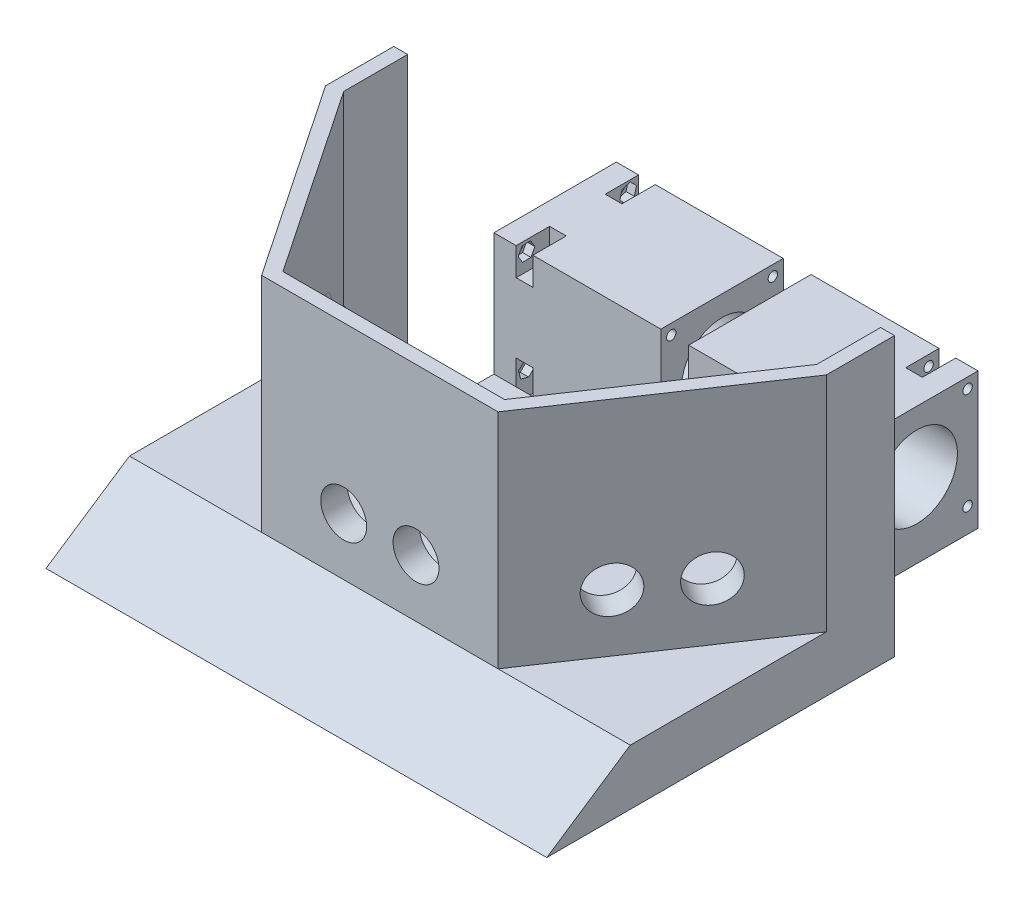
from build123d import *

# Parameters (mm, degrees)
SKETCH1_W           = 180
SKETCH1_H           = 100
BOSS_EXTRUDE1_DEPTH = 150
CUT_EXTRUDE2_DEPTH  = 80
SHELL1_T            = -5
BOSS_EXTRUDE2_DEPTH = 180
SKETCH26_W          = 180
SKETCH26_H          = 95
CUT_EXTRUDE10_DEPTH = 5
SKETCH27_W          = 50
SKETCH27_H          = 95
CUT_EXTRUDE11_DEPTH = 261.057303789
SKETCH28_R          = 8.25
CUT_EXTRUDE12_DEPTH = 82
SKETCH29_R          = 8.25
CUT_EXTRUDE13_DEPTH = 82
SKETCH30_R          = 8.25
CUT_EXTRUDE14_DEPTH = 82
SKETCH31_R          = 10.25
SKETCH31_R_2        = 8.25
BOSS_EXTRUDE4_DEPTH = 4.5
SKETCH33_R          = 10.25
SKETCH33_R_2        = 8.25
BOSS_EXTRUDE5_DEPTH = 4.5
SKETCH34_R          = 10.25
SKETCH34_R_2        = 8.25
BOSS_EXTRUDE6_DEPTH = 4.5
FILLET1_R           = 3
SKETCH36_W          = 60
SKETCH36_H          = 44
BOSS_EXTRUDE7_DEPTH = 44
SKETCH37_R          = 14.6
CUT_EXTRUDE15_DEPTH = 146
SKETCH42_R          = 1.6875
CUT_EXTRUDE19_DEPTH = 179.1
SKETCH43_W          = 25
SKETCH43_H          = 55
CUT_EXTRUDE20_DEPTH = 6.2
SKETCH47_W          = 6
SKETCH47_H          = 12
CUT_EXTRUDE24_DEPTH = 10
SKETCH55_W          = 6
SKETCH55_H          = 12
CUT_EXTRUDE31_DEPTH = 14
CUT_EXTRUDE36_DEPTH = 3
CUT_EXTRUDE37_DEPTH = 3
CUT_EXTRUDE38_DEPTH = 3
CUT_EXTRUDE39_DEPTH = 3


with BuildPart() as part:
    # Sketch1 → Boss-Extrude1 (new body)
    with BuildSketch(Plane.XY):
        with Locations((13.092783505, 3.195876289)):
            Rectangle(SKETCH1_W, SKETCH1_H)
    extrude(amount=BOSS_EXTRUDE1_DEPTH)

    # Sketch4 → Cut-Extrude2 (cut)
    with BuildSketch(Plane(origin=(0, 53.195876289, 0), x_dir=(1, 0, 0), z_dir=(0, 1, 0))):
        Polygon((-76.907216495, -79.510639101), (-29.407216495, -150), (-76.907216495, -150), align=None)
        Polygon((55.592783505, -150), (103.092783505, -150), (103.092783505, -79.510639101), align=None)
    extrude(amount=-CUT_EXTRUDE2_DEPTH, mode=Mode.SUBTRACT)

    # Shell1
    shell1_openings = [part.faces().sort_by_distance(p)[0] for p in [
        (13.092783505, 53.195876289, 67.708935527),
    ]]
    offset(amount=SHELL1_T, openings=shell1_openings, kind=Kind.INTERSECTION)

    # Sketch6 → Boss-Extrude2 (add)
    with BuildSketch(Plane(origin=(103.092783505, 0, 0), x_dir=(0, 0, -1), z_dir=(1, 0, 0))):
        Polygon((-150, -26.804123711), (-150, -46.804123711), (-180, -46.804123711), align=None)
    extrude(amount=-BOSS_EXTRUDE2_DEPTH)

    # Sketch26 → Cut-Extrude10 (cut)
    with BuildSketch(Plane(origin=(0, 0, 0), x_dir=(-1, 0, 0), z_dir=(0, 0, -1))):
        with Locations((-13.092783505, 5.695876289)):
            Rectangle(SKETCH26_W, SKETCH26_H)
    extrude(amount=-CUT_EXTRUDE10_DEPTH, mode=Mode.SUBTRACT)

    # Sketch27 → Cut-Extrude11 (cut, through all)
    with BuildSketch(Plane(origin=(103.092783505, 0, 0), x_dir=(0, 0, -1), z_dir=(1, 0, 0))):
        with Locations((-30, 5.695876289)):
            Rectangle(SKETCH27_W, SKETCH27_H)
    extrude(amount=-CUT_EXTRUDE11_DEPTH, mode=Mode.SUBTRACT)

    # Sketch28 → Cut-Extrude12 (cut)
    with BuildSketch(Plane(origin=(-89.737550639, 0, 60.47059586), x_dir=(0.5588235294117647, 0, 0.8292865988159815), z_dir=(-0.8292865988159815, 0, 0.5588235294117647))):
        with Locations((52.459545311, -6.204123711)):
            Circle(SKETCH28_R)
        with Locations((78.459545311, -6.204123711)):
            Circle(SKETCH28_R)
    extrude(amount=-CUT_EXTRUDE12_DEPTH, mode=Mode.SUBTRACT)

    # Sketch29 → Cut-Extrude13 (cut)
    with BuildSketch(Plane(origin=(107.745790927, 0, 72.605638691), x_dir=(0.5588235294117646, 0, -0.8292865988159815), z_dir=(0.8292865988159815, 0, 0.5588235294117646))):
        with Locations((-63.826434334, -6.204123711)):
            Circle(SKETCH29_R)
        with Locations((-37.826434334, -6.204123711)):
            Circle(SKETCH29_R)
    extrude(amount=-CUT_EXTRUDE13_DEPTH, mode=Mode.SUBTRACT)

    # Sketch30 → Cut-Extrude14 (cut)
    with BuildSketch(Plane.XY.offset(150)):
        with Locations((0.092783505, -6.204123711)):
            Circle(SKETCH30_R)
        with Locations((26.092783505, -6.204123711)):
            Circle(SKETCH30_R)
    extrude(amount=-CUT_EXTRUDE14_DEPTH, mode=Mode.SUBTRACT)

    # Sketch31 → Boss-Extrude4 (add)
    # profile 1 of 2: a face of its own
    with BuildSketch(Plane(origin=(103.599357933, 0, 69.811521044), x_dir=(-0.5588235294117646, 0, 0.8292865988159815), z_dir=(-0.8292865988159815, 0, -0.5588235294117646))):
        with Locations(Location((63.826434334, -6.204123711, 0), (0, 0, 180))):
            Circle(SKETCH31_R)
        with Locations(Location((63.826434334, -6.204123711, 0), (0, 0, 180))):
            Circle(SKETCH31_R_2, mode=Mode.SUBTRACT)
    # profile 2 of 2: a face of its own
    with BuildSketch(Plane(origin=(103.599357933, 0, 69.811521044), x_dir=(-0.5588235294117646, 0, 0.8292865988159815), z_dir=(-0.8292865988159815, 0, -0.5588235294117646))):
        with Locations(Location((37.826434334, -6.204123711, 0), (0, 0, 180))):
            Circle(SKETCH31_R)
        with Locations(Location((37.826434334, -6.204123711, 0), (0, 0, 180))):
            Circle(SKETCH31_R_2, mode=Mode.SUBTRACT)
    extrude(amount=BOSS_EXTRUDE4_DEPTH)

    # Sketch33 → Boss-Extrude5 (add)
    # profile 1 of 2: a face of its own
    with BuildSketch(Plane(origin=(0, 0, 145), x_dir=(-1, 0, 0), z_dir=(0, 0, -1))):
        with Locations(Location((-26.092783505, -6.204123711, 0), (0, 0, 180))):
            Circle(SKETCH33_R)
        with Locations(Location((-26.092783505, -6.204123711, 0), (0, 0, 180))):
            Circle(SKETCH33_R_2, mode=Mode.SUBTRACT)
    # profile 2 of 2: a face of its own
    with BuildSketch(Plane(origin=(0, 0, 145), x_dir=(-1, 0, 0), z_dir=(0, 0, -1))):
        with Locations(Location((-0.092783505, -6.204123711, 0), (0, 0, 180))):
            Circle(SKETCH33_R)
        with Locations(Location((-0.092783505, -6.204123711, 0), (0, 0, 180))):
            Circle(SKETCH33_R_2, mode=Mode.SUBTRACT)
    extrude(amount=BOSS_EXTRUDE5_DEPTH)

    # Sketch34 → Boss-Extrude6 (add)
    # profile 1 of 2: a face of its own
    with BuildSketch(Plane(origin=(-85.591117645, 0, 57.676478213), x_dir=(-0.5588235294117647, 0, -0.8292865988159815), z_dir=(0.8292865988159815, 0, -0.5588235294117647))):
        with Locations(Location((-78.459545311, -6.204123711, 0), (0, 0, 180))):
            Circle(SKETCH34_R)
        with Locations(Location((-78.459545311, -6.204123711, 0), (0, 0, 180))):
            Circle(SKETCH34_R_2, mode=Mode.SUBTRACT)
    # profile 2 of 2: a face of its own
    with BuildSketch(Plane(origin=(-85.591117645, 0, 57.676478213), x_dir=(-0.5588235294117647, 0, -0.8292865988159815), z_dir=(0.8292865988159815, 0, -0.5588235294117647))):
        with Locations(Location((-52.459545311, -6.204123711, 0), (0, 0, 180))):
            Circle(SKETCH34_R)
        with Locations(Location((-52.459545311, -6.204123711, 0), (0, 0, 180))):
            Circle(SKETCH34_R_2, mode=Mode.SUBTRACT)
    extrude(amount=BOSS_EXTRUDE6_DEPTH)

    # Fillet1
    # the kernel refuses this fillet: 3 mm, written as the material it adds along each edge
    with BuildSketch(Plane(origin=(67.931644629, -6.204123711, 122.741927688), x_dir=(0.5588235294117648, 0, -0.8292865988159814), z_dir=(0, 1, 0))) as fillet1_piece_1:
        with BuildLine():
            CenterArc((10.25 + FILLET1_R, FILLET1_R), FILLET1_R, 180, 90)
            Line((10.25, FILLET1_R), (10.25, 0))
            Line((10.25, 0), (10.25 + FILLET1_R, 0))
        make_face()
    revolve(axis=Axis((67.931644629, -6.204123711, 122.741927688), (-0.8292865988159815, 0, -0.5588235294117646)))
    with BuildSketch(Plane(origin=(82.461056393, -6.204123711, 101.180476119), x_dir=(0.5588235294117648, 0, -0.8292865988159814), z_dir=(0, 1, 0))) as fillet1_piece_2:
        with BuildLine():
            CenterArc((10.25 + FILLET1_R, FILLET1_R), FILLET1_R, 180, 90)
            Line((10.25, FILLET1_R), (10.25, 0))
            Line((10.25, 0), (10.25 + FILLET1_R, 0))
        make_face()
    revolve(axis=Axis((82.461056393, -6.204123711, 101.180476119), (-0.8292865988159815, 0, -0.5588235294117646)))
    with BuildSketch(Plane(origin=(26.092783505, -6.204123711, 145), x_dir=(1, 0, 0), z_dir=(0, 1, 0))) as fillet1_piece_3:
        with BuildLine():
            CenterArc((10.25 + FILLET1_R, FILLET1_R), FILLET1_R, 180, 90)
            Line((10.25, FILLET1_R), (10.25, 0))
            Line((10.25, 0), (10.25 + FILLET1_R, 0))
        make_face()
    revolve(axis=Axis((26.092783505, -6.204123711, 145), (0, 0, -1)))
    with BuildSketch(Plane(origin=(0.092783505, -6.204123711, 145), x_dir=(1, 0, 0), z_dir=(0, 1, 0))) as fillet1_piece_4:
        with BuildLine():
            CenterArc((10.25 + FILLET1_R, FILLET1_R), FILLET1_R, 180, 90)
            Line((10.25, FILLET1_R), (10.25, 0))
            Line((10.25, 0), (10.25 + FILLET1_R, 0))
        make_face()
    revolve(axis=Axis((0.092783505, -6.204123711, 145), (0, 0, -1)))
    with BuildSketch(Plane(origin=(-41.746077618, -6.204123711, 122.741927688), x_dir=(0.5588235294117645, 0, 0.8292865988159817), z_dir=(0, 1, 0))) as fillet1_piece_5:
        with BuildLine():
            CenterArc((10.25 + FILLET1_R, FILLET1_R), FILLET1_R, 180, 90)
            Line((10.25, FILLET1_R), (10.25, 0))
            Line((10.25, 0), (10.25 + FILLET1_R, 0))
        make_face()
    revolve(axis=Axis((-41.746077618, -6.204123711, 122.741927688), (0.8292865988159815, 0, -0.5588235294117647)))
    with BuildSketch(Plane(origin=(-56.275489383, -6.204123711, 101.180476119), x_dir=(0.5588235294117649, 0, 0.8292865988159813), z_dir=(0, 1, 0))) as fillet1_piece_6:
        with BuildLine():
            CenterArc((10.25 + FILLET1_R, FILLET1_R), FILLET1_R, 180, 90)
            Line((10.25, FILLET1_R), (10.25, 0))
            Line((10.25, 0), (10.25 + FILLET1_R, 0))
        make_face()
    revolve(axis=Axis((-56.275489383, -6.204123711, 101.180476119), (0.8292865988159815, 0, -0.5588235294117647)))

    # Sketch36 → Boss-Extrude7 (add)
    with BuildSketch(Plane(origin=(0, -41.804123711, 0), x_dir=(1, 0, 0), z_dir=(0, 1, 0))):
        with Locations((-21.907216495, -22)):
            Rectangle(SKETCH36_W, SKETCH36_H)
        with Locations((48.092783505, -22)):
            Rectangle(SKETCH36_W, SKETCH36_H)
    extrude(amount=BOSS_EXTRUDE7_DEPTH)

    # Sketch37 → Cut-Extrude15 (cut)
    with BuildSketch(Plane.ZY.offset(51.907216495)):
        with Locations((22, -19.804123711)):
            Circle(SKETCH37_R)
    extrude(amount=-CUT_EXTRUDE15_DEPTH, mode=Mode.SUBTRACT)

    # Sketch42 → Cut-Extrude19 (cut)
    with BuildSketch(Plane(origin=(78.092783505, 0, 0), x_dir=(0, 0, -1), z_dir=(1, 0, 0))):
        with Locations((-3.74, -1.544123711)):
            Circle(SKETCH42_R)
        with Locations((-3.74, -38.064123711)):
            Circle(SKETCH42_R)
        with Locations((-40.26, -38.064123711)):
            Circle(SKETCH42_R)
        with Locations((-40.26, -1.544123711)):
            Circle(SKETCH42_R)
    extrude(amount=-CUT_EXTRUDE19_DEPTH, mode=Mode.SUBTRACT)

    # Sketch43 → Cut-Extrude20 (cut)
    with BuildSketch(Plane(origin=(0, -41.804123711, 0), x_dir=(1, 0, 0), z_dir=(0, 1, 0))):
        with Locations((90.592783505, -27.5)):
            Rectangle(SKETCH43_W, SKETCH43_H)
        with Locations((-64.407216495, -27.5)):
            Rectangle(SKETCH43_W, SKETCH43_H)
    extrude(amount=-CUT_EXTRUDE20_DEPTH, mode=Mode.SUBTRACT)

    # Sketch47 → Cut-Extrude24 (cut)
    with BuildSketch(Plane(origin=(0, 2.195876289, 0), x_dir=(1, 0, 0), z_dir=(0, 1, 0))):
        with Locations((-40.907216495, -6)):
            Rectangle(SKETCH47_W, SKETCH47_H)
        with Locations((-40.907216495, -38)):
            Rectangle(SKETCH47_W, SKETCH47_H)
        with Locations((67.092783505, -38)):
            Rectangle(SKETCH47_W, SKETCH47_H)
        with Locations((67.092783505, -6)):
            Rectangle(SKETCH47_W, SKETCH47_H)
    extrude(amount=-CUT_EXTRUDE24_DEPTH, mode=Mode.SUBTRACT)

    # Sketch55 → Cut-Extrude31 (cut)
    with BuildSketch(Plane.XZ.offset(46.804123711)):
        with Locations((67.092783505, 38)):
            Rectangle(SKETCH55_W, SKETCH55_H)
        with Locations((67.092783505, 6)):
            Rectangle(SKETCH55_W, SKETCH55_H)
        with Locations((-40.907216495, 38)):
            Rectangle(SKETCH55_W, SKETCH55_H)
        with Locations((-40.907216495, 6)):
            Rectangle(SKETCH55_W, SKETCH55_H)
    extrude(amount=-CUT_EXTRUDE31_DEPTH, mode=Mode.SUBTRACT)

    # Sketch63 → Cut-Extrude36 (cut)
    with BuildSketch(Plane.ZY.offset(-70.092783505)):
        Polygon((6.74, -1.521470627), (5.220381853, 1.065279042), (2.220381853, 1.042625958), (0.74, -1.566776796), (2.259618147, -4.153526465), (5.259618147, -4.13087338), align=None)
        Polygon((43.236461356, -1.919194101), (42.073051163, 0.846032242), (39.096589807, 1.221102631), (37.283538644, -1.169053322), (38.446948837, -3.934279664), (41.423410193, -4.309350054), align=None)
    extrude(amount=-CUT_EXTRUDE36_DEPTH, mode=Mode.SUBTRACT)

    # Sketch64 → Cut-Extrude37 (cut)
    with BuildSketch(Plane.ZY.offset(-70.092783505)):
        Polygon((6.74, -38.064123711), (5.24, -35.4660475), (2.24, -35.4660475), (0.74, -38.064123711), (2.24, -40.662199923), (5.24, -40.662199923), align=None)
        Polygon((43.26, -38.064123711), (41.76, -35.4660475), (38.76, -35.4660475), (37.26, -38.064123711), (38.76, -40.662199923), (41.76, -40.662199923), align=None)
    extrude(amount=-CUT_EXTRUDE37_DEPTH, mode=Mode.SUBTRACT)

    # Sketch65 → Cut-Extrude38 (cut)
    with BuildSketch(Plane(origin=(-43.907216495, 0, 0), x_dir=(0, 0, -1), z_dir=(1, 0, 0))):
        Polygon((-2.95758027, 1.468247662), (-5.95758027, 0.639657338), (-6.74, -2.372714036), (-4.52241973, -4.556495085), (-1.52241973, -3.727904761), (-0.74, -0.715533387), align=None)
        Polygon((-38.826175191, 1.091051125), (-41.825215947, 1.015192416), (-43.259040756, -1.61998242), (-41.693824809, -4.179298548), (-38.694784053, -4.103439839), (-37.260959244, -1.468265002), align=None)
    extrude(amount=-CUT_EXTRUDE38_DEPTH, mode=Mode.SUBTRACT)

    # Sketch66 → Cut-Extrude39 (cut)
    with BuildSketch(Plane(origin=(-43.907216495, 0, 0), x_dir=(0, 0, -1), z_dir=(1, 0, 0))):
        Polygon((-0.74, -38.420023124), (-1.931782067, -35.643997206), (-4.931782067, -35.288097794), (-6.74, -37.708224298), (-5.548217933, -40.484250216), (-2.548217933, -40.840149629), align=None)
        Polygon((-39.525441081, -40.972804373), (-37.373729196, -38.882317358), (-38.108288115, -35.973636696), (-40.994558919, -35.155443049), (-43.146270804, -37.245930065), (-42.411711885, -40.154610727), align=None)
    extrude(amount=-CUT_EXTRUDE39_DEPTH, mode=Mode.SUBTRACT)


solid = part.part
